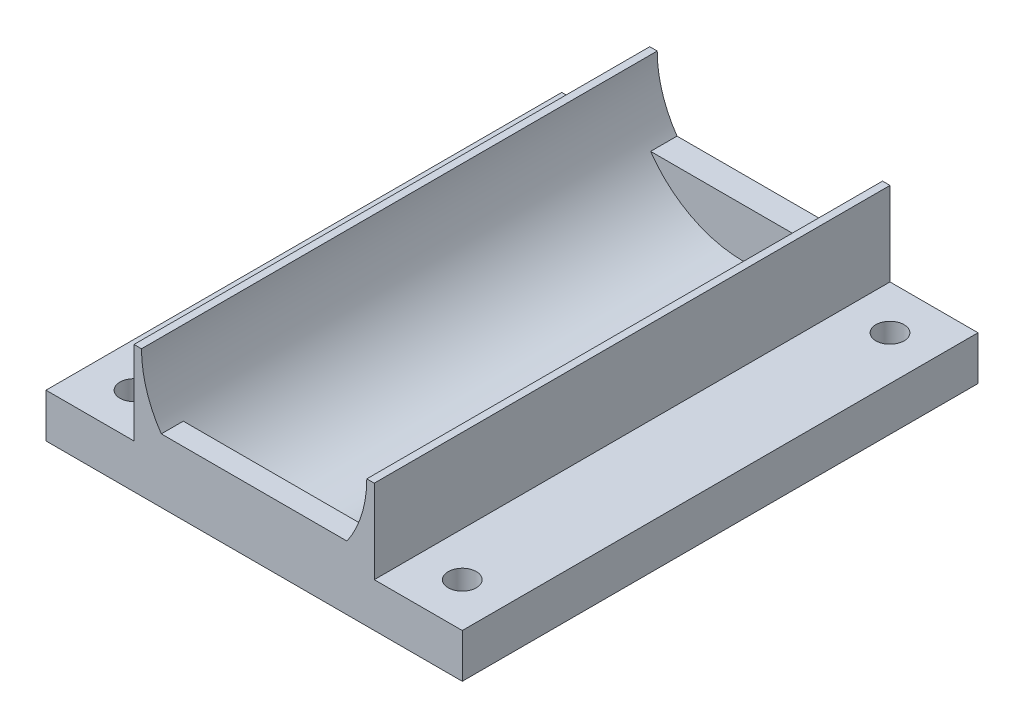
from build123d import *

# Parameters (mm, degrees)
SKETCH_1_W          = 27.3
SKETCH_1_H          = 58.6
EXTRUDE_1_DEPTH     = 14.5
SKETCH_3_R          = 12.8
CUT_EXTRUDE_1_DEPTH = 67.253301805
SKETCH_7_W          = 27.3
SKETCH_7_H          = 7.25
EXTRUDE_2_DEPTH     = 3
EXTRUDE_START       = -58.6
EXTRUDE_3_DEPTH     = 2.5
SKETCH_1_3_W        = 10
SKETCH_1_3_H        = 58.6
SKETCH_1_3_R        = 1.6
EXTRUDE_4_DEPTH     = 5


with BuildPart() as part:
    # Эскиз1 → Бобышка-Вытянуть1 (new body)
    with BuildSketch(Plane(origin=(0, 0, 0), x_dir=(1, 0, 0), z_dir=(0, 1, 0))):
        with Locations((13.65, 29.3)):
            Rectangle(SKETCH_1_W, SKETCH_1_H)
    extrude(amount=EXTRUDE_1_DEPTH)

    # Эскиз3 → Вырез-Вытянуть1 (cut, through all)
    with BuildSketch(Plane.XY):
        with Locations((13.65, 14.5)):
            Circle(SKETCH_3_R)
    extrude(amount=-CUT_EXTRUDE_1_DEPTH, mode=Mode.SUBTRACT)

    # Эскиз7 → Бобышка-Вытянуть2 (add)
    with BuildSketch(Plane(origin=(0, 0, -58.6), x_dir=(-1, 0, 0), z_dir=(0, 0, -1))):
        with Locations((-13.65, 3.625)):
            Rectangle(SKETCH_7_W, SKETCH_7_H)
    extrude(amount=-EXTRUDE_2_DEPTH)

    # Эскиз7<2> → Бобышка-Вытянуть3 (add)
    with BuildSketch(Plane(origin=(0, 0, -58.6), x_dir=(-1, 0, 0), z_dir=(0, 0, -1)).offset(EXTRUDE_START)):
        with BuildLine():
            Line((-27.3, 14.5), (-27.3, 7.25))
            Line((-27.3, 7.25), (-24.198815099, 7.25))
            ThreePointArc((-24.198815099, 7.25), (-25.874255259, 10.704267743), (-26.45, 14.5))
            Line((-26.45, 14.5), (-27.3, 14.5))
        make_face()
        with BuildLine():
            Line((-24.198815099, 7.25), (-27.3, 7.25))
            Line((-27.3, 7.25), (-27.3, 0))
            Line((-27.3, 0), (0, 0))
            Line((0, 0), (0, 7.25))
            Line((0, 7.25), (-3.101184901, 7.25))
            ThreePointArc((-3.101184901, 7.25), (-13.65, 1.7), (-24.198815099, 7.25))
        make_face()
        with BuildLine():
            Line((-3.101184901, 7.25), (-24.198815099, 7.25))
            ThreePointArc((-24.198815099, 7.25), (-13.65, 1.7), (-3.101184901, 7.25))
        make_face()
        with BuildLine():
            ThreePointArc((-0.85, 14.5), (-1.425744741, 10.704267743), (-3.101184901, 7.25))
            Line((-3.101184901, 7.25), (0, 7.25))
            Line((0, 7.25), (0, 14.5))
            Line((0, 14.5), (-0.85, 14.5))
        make_face()
    extrude(amount=EXTRUDE_3_DEPTH)

    # Эскиз1<3> → Бобышка-Вытянуть4 (add)
    # profile 1 of 2: a face of its own
    with BuildSketch(Plane(origin=(0, 0, 0), x_dir=(1, 0, 0), z_dir=(0, 1, 0))):
        with Locations((-5, 29.3)):
            Rectangle(SKETCH_1_3_W, SKETCH_1_3_H)
        with Locations((-5, 5)):
            Circle(SKETCH_1_3_R, mode=Mode.SUBTRACT)
        with Locations((-5, 53.6)):
            Circle(SKETCH_1_3_R, mode=Mode.SUBTRACT)
    # profile 2 of 2: a face of its own
    with BuildSketch(Plane(origin=(0, 0, 0), x_dir=(1, 0, 0), z_dir=(0, 1, 0))):
        with Locations((32.3, 29.3)):
            Rectangle(SKETCH_1_3_W, SKETCH_1_3_H)
        with Locations((32.3, 5)):
            Circle(SKETCH_1_3_R, mode=Mode.SUBTRACT)
        with Locations((32.3, 53.6)):
            Circle(SKETCH_1_3_R, mode=Mode.SUBTRACT)
    extrude(amount=EXTRUDE_4_DEPTH)


solid = part.part
